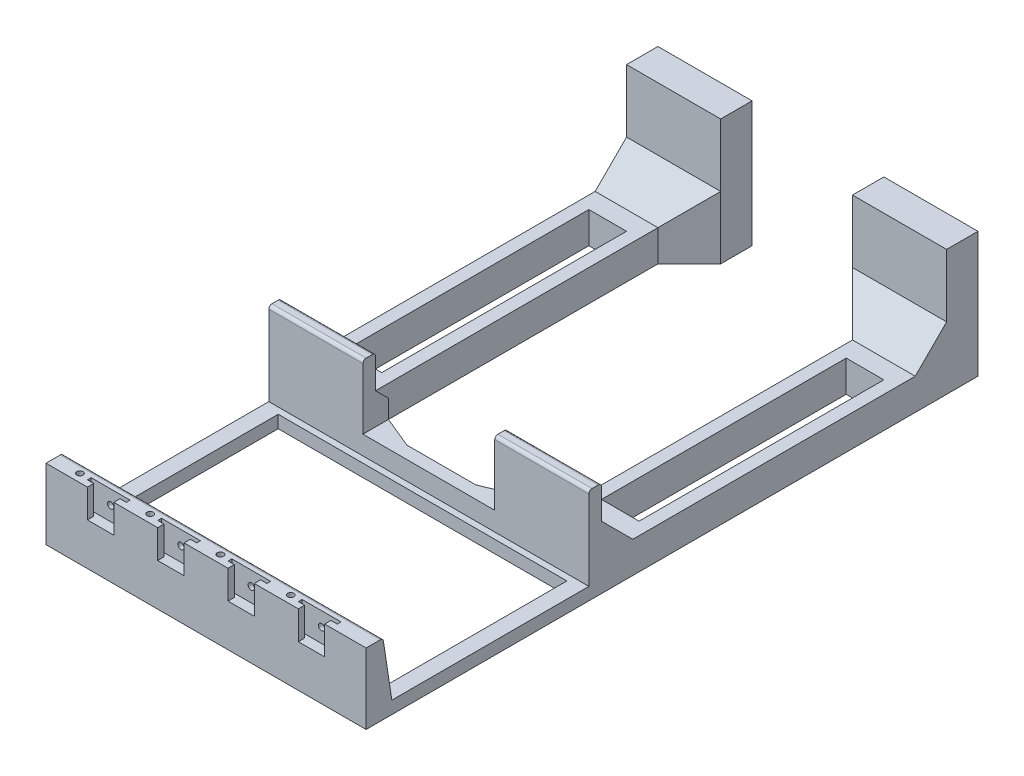
from build123d import *

# Parameters (mm, degrees)
SKETCH_1_W           = 102
SKETCH_1_H           = 75
EXTRUDE_1_DEPTH      = 22.5
CUT_EXTRUDE_1_DEPTH  = 9.06
SKETCH_3_W           = 102
SKETCH_3_H           = 66.8
CUT_EXTRUDE_2_DEPTH  = 12
SKETCH_4_W           = 62.8
SKETCH_4_H           = 6.5
CUT_EXTRUDE_3_DEPTH  = 129.589463021
SKETCH_6_W           = 102
SKETCH_6_H           = 4
EXTRUDE_2_DEPTH      = 20
SKETCH_7_W           = 92
SKETCH_7_H           = 58.8
CUT_EXTRUDE_5_DEPTH  = 8
CUT_EXTRUDE_6_DEPTH  = 108
FILLET_2_R           = 1
SKETCH_10_R          = 1
CUT_EXTRUDE_7_DEPTH  = 10
SKETCH_14_R          = 1
CUT_EXTRUDE_8_DEPTH  = 10
SKETCH_15_W          = 20
SKETCH_15_H          = 10
EXTRUDE_3_DEPTH      = 120
SKETCH_16_W          = 10
SKETCH_16_H          = 10
EXTRUDE_4_DEPTH      = 80
CHAMFER_1_SIZE       = 10
SKETCH_17_W          = 102
SKETCH_17_H          = 10
EXTRUDE_5_DEPTH      = 30
CUT_EXTRUDE_9_DEPTH  = 50
SKETCH_20_W          = 12
SKETCH_20_H          = 78
CUT_EXTRUDE_10_DEPTH = 50
SKETCH_21_W          = 4
SKETCH_21_H          = 10
EXTRUDE_6_DEPTH      = 50
CHAMFER_2_SIZE       = 10
CHAMFER_3_SIZE       = 10


with BuildPart() as part:
    # 草图1 → 凸台-拉伸1 (new body)
    with BuildSketch(Plane(origin=(0, 0, 0), x_dir=(1, 0, 0), z_dir=(0, 1, 0))):
        with Locations((-51, 37.5)):
            Rectangle(SKETCH_1_W, SKETCH_1_H)
    extrude(amount=EXTRUDE_1_DEPTH)

    # 草图2 → 切除-拉伸1 (cut)
    with BuildSketch(Plane(origin=(0, 22.5, 0), x_dir=(1, 0, 0), z_dir=(0, 1, 0))):
        Polygon((-90.8, 2), (-88.8, 2), (-88.8, 0), (-80.4, 0), (-80.4, 2), (-78.4, 2), (-78.4, 3.2), (-90.8, 3.2), align=None)
        Polygon((-68.4, 2), (-66.4, 2), (-66.4, 0), (-58, 0), (-58, 2), (-56, 2), (-56, 3.2), (-68.4, 3.2), align=None)
        Polygon((-46, 3.2), (-33.6, 3.2), (-33.6, 2), (-35.6, 2), (-35.6, 0), (-44, 0), (-44, 2), (-46, 2), align=None)
        Polygon((-23.6, 3.2), (-11.2, 3.2), (-11.2, 2), (-13.2, 2), (-13.2, 0), (-21.6, 0), (-21.6, 2), (-23.6, 2), align=None)
    extrude(amount=-CUT_EXTRUDE_1_DEPTH, mode=Mode.SUBTRACT)

    # 草图3 → 切除-拉伸2 (cut)
    with BuildSketch(Plane(origin=(0, 22.5, 0), x_dir=(1, 0, 0), z_dir=(0, 1, 0))):
        with Locations((-51, 41.6)):
            Rectangle(SKETCH_3_W, SKETCH_3_H)
    extrude(amount=-CUT_EXTRUDE_2_DEPTH, mode=Mode.SUBTRACT)

    # 草图4 → 切除-拉伸3 (cut, through all)
    with BuildSketch(Plane.ZY.offset(102)):
        with Locations((-39.6, 7.25)):
            Rectangle(SKETCH_4_W, SKETCH_4_H)
    extrude(amount=-CUT_EXTRUDE_3_DEPTH, mode=Mode.SUBTRACT)

    # 草图6 → 凸台-拉伸2 (add)
    with BuildSketch(Plane(origin=(0, 10.5, 0), x_dir=(1, 0, 0), z_dir=(0, 1, 0))):
        with Locations((-51, 73)):
            Rectangle(SKETCH_6_W, SKETCH_6_H)
    extrude(amount=EXTRUDE_2_DEPTH)

    # 草图7 → 切除-拉伸5 (cut)
    with BuildSketch(Plane(origin=(0, 4, 0), x_dir=(1, 0, 0), z_dir=(0, 1, 0))):
        with Locations((-51, 39.6)):
            Rectangle(SKETCH_7_W, SKETCH_7_H)
    extrude(amount=-CUT_EXTRUDE_5_DEPTH, mode=Mode.SUBTRACT)

    # 草图9 → 切除-拉伸6 (cut)
    with BuildSketch(Plane.ZY.offset(102)):
        Polygon((-8.2, 22.5), (-5.4, 22.5), (-8.2, 4), align=None)
    extrude(amount=-CUT_EXTRUDE_6_DEPTH, mode=Mode.SUBTRACT)

    # 圆角2
    fillet_2_edges = [part.edges().sort_by_distance(p)[0] for p in [
        (-51, 30.5, -71),
        (-51, 30.5, -75),
        (-51, 22.5, -5.4),
    ]]
    fillet(fillet_2_edges, radius=FILLET_2_R)

    # 草图10 → 切除-拉伸7 (cut)
    with BuildSketch(Plane.XY.offset(-3.2)):
        with Locations((-84.6, 17.97)):
            Circle(SKETCH_10_R)
        with Locations((-62.2, 17.97)):
            Circle(SKETCH_10_R)
        with Locations(Location((-39.8, 17.97, 0), (0, 0, 90))):
            Circle(SKETCH_10_R)
        with Locations(Location((-17.4, 17.97, 0), (0, 0, 90))):
            Circle(SKETCH_10_R)
    extrude(amount=-CUT_EXTRUDE_7_DEPTH, mode=Mode.SUBTRACT)

    # 草图14 → 切除-拉伸8 (cut)
    with BuildSketch(Plane(origin=(0, 22.5, 0), x_dir=(1, 0, 0), z_dir=(0, 1, 0))):
        with Locations(Location((-93.8, 2.6, 0), (0, 0, 270))):
            Circle(SKETCH_14_R)
        with Locations(Location((-71.4, 2.6, 0), (0, 0, 270))):
            Circle(SKETCH_14_R)
        with Locations(Location((-49, 2.6, 0), (0, 0, 270))):
            Circle(SKETCH_14_R)
        with Locations(Location((-26.6, 2.6, 0), (0, 0, 270))):
            Circle(SKETCH_14_R)
    extrude(amount=-CUT_EXTRUDE_8_DEPTH, mode=Mode.SUBTRACT)

    # 草图15 → 凸台-拉伸3 (add)
    with BuildSketch(Plane(origin=(0, 0, -75), x_dir=(-1, 0, 0), z_dir=(0, 0, -1))):
        with Locations((10, 5)):
            Rectangle(SKETCH_15_W, SKETCH_15_H)
        with Locations((92, 5)):
            Rectangle(SKETCH_15_W, SKETCH_15_H)
    extrude(amount=EXTRUDE_3_DEPTH)

    # 草图16 → 凸台-拉伸4 (add)
    with BuildSketch(Plane(origin=(-82, 0, 0), x_dir=(0, 0, -1), z_dir=(1, 0, 0))):
        with Locations((190, 5)):
            Rectangle(SKETCH_16_W, SKETCH_16_H)
    extrude(amount=EXTRUDE_4_DEPTH)

    # 倒角1
    chamfer_1_edges = [part.edges().sort_by_distance(p)[0] for p in [
        (-20, 5, -75),
        (-82, 5, -75),
        (-20, 5, -185),
        (-82, 5, -185),
    ]]
    chamfer(chamfer_1_edges, length=CHAMFER_1_SIZE)

    # 草图17 → 凸台-拉伸5 (add)
    with BuildSketch(Plane(origin=(0, 10, 0), x_dir=(1, 0, 0), z_dir=(0, 1, 0))):
        with Locations((-51, 190)):
            Rectangle(SKETCH_17_W, SKETCH_17_H)
    extrude(amount=EXTRUDE_5_DEPTH)

    # 草图19 → 切除-拉伸9 (cut)
    with BuildSketch(Plane(origin=(0, 40, 0), x_dir=(1, 0, 0), z_dir=(0, 1, 0))):
        Polygon((-72, 185), (-72, 75), (-72, 71), (-30, 71), (-30, 75), (-30, 185), (-30, 195), (-72, 195), align=None)
    extrude(amount=-CUT_EXTRUDE_9_DEPTH, mode=Mode.SUBTRACT)

    # 草图20 → 切除-拉伸10 (cut)
    with BuildSketch(Plane(origin=(0, 10, 0), x_dir=(1, 0, 0), z_dir=(0, 1, 0))):
        with Locations((-92, 130)):
            Rectangle(SKETCH_20_W, SKETCH_20_H)
        with Locations((-10, 130)):
            Rectangle(SKETCH_20_W, SKETCH_20_H)
    extrude(amount=-CUT_EXTRUDE_10_DEPTH, mode=Mode.SUBTRACT)

    # 草图21 → 凸台-拉伸6 (add)
    with BuildSketch(Plane(origin=(-72, 0, 0), x_dir=(0, 0, -1), z_dir=(1, 0, 0))):
        with Locations((73, 5)):
            Rectangle(SKETCH_21_W, SKETCH_21_H)
    extrude(amount=EXTRUDE_6_DEPTH)

    # 倒角2
    # the kernel refuses this chamfer: 10 mm, written as the material it adds along each edge
    with BuildSketch(Plane(origin=(-30, 0, -75), x_dir=(-0.9998910622590237, 0, 0.01476020374253316), z_dir=(0, 1, 0))) as chamfer_2_piece_1:
        Polygon((CHAMFER_2_SIZE * 0.999891062259, -CHAMFER_2_SIZE * 0.0147602037425), (-CHAMFER_2_SIZE * 0.717466790729, -CHAMFER_2_SIZE * 0.696592710413), (0, 0), align=None)
    extrude(amount=10)
    with BuildSketch(Plane(origin=(-72, 0, -75), x_dir=(0.9998910622590237, 0, 0.01476020374253316), z_dir=(0, 1, 0))) as chamfer_2_piece_2:
        Polygon((CHAMFER_2_SIZE * 0.999891062259, CHAMFER_2_SIZE * 0.0147602037425), (-CHAMFER_2_SIZE * 0.717466790729, CHAMFER_2_SIZE * 0.696592710413), (0, 0), align=None)
    extrude(amount=10)

    # 倒角3
    # the kernel refuses this chamfer: 10 mm, written as the material it adds along each edge
    with BuildSketch(Plane(origin=(-30, 10, -75), x_dir=(0, -0.027495876610585588, -0.9996219169112968), z_dir=(1, 0, 0))) as chamfer_3_piece_1_section:
        Polygon((CHAMFER_3_SIZE * 0.999621916911, CHAMFER_3_SIZE * 0.0274958766106), (-CHAMFER_3_SIZE * 0.0274958766106, CHAMFER_3_SIZE * 0.999621916911), (0, 0), align=None)
    chamfer_3_piece_1 = extrude(amount=30, mode=Mode.PRIVATE)
    chamfer_3_piece_1 = split(chamfer_3_piece_1, bisect_by=Plane(origin=(-27.264199431, 13.202688984, -77.735800569), z_dir=(-0.7071067811865476, 0, -0.7071067811865476)), keep=Keep.TOP, mode=Mode.PRIVATE)
    chamfer_3_piece_1 = split(chamfer_3_piece_1, bisect_by=Plane(origin=(-28.501657804, 13.202688984, -79.762769282), z_dir=(0.382683432365518, 0, 0.9238795325111094)), keep=Keep.TOP, mode=Mode.PRIVATE)
    add(chamfer_3_piece_1)
    with BuildSketch(Plane(origin=(-30, 10, -75), x_dir=(0, -0.027495876610585588, -0.9996219169112968), z_dir=(1, 0, 0))) as chamfer_3_piece_2_section:
        Polygon((CHAMFER_3_SIZE * 0.999621916911, CHAMFER_3_SIZE * 0.0274958766106), (-CHAMFER_3_SIZE * 0.0274958766106, CHAMFER_3_SIZE * 0.999621916911), (0, 0), align=None)
    chamfer_3_piece_2 = extrude(amount=30, mode=Mode.PRIVATE)
    chamfer_3_piece_2 = split(chamfer_3_piece_2, bisect_by=Plane(origin=(-20, 10.692968827, -83.273838091), z_dir=(-1, 0, 0)), keep=Keep.TOP, mode=Mode.PRIVATE)
    chamfer_3_piece_2 = split(chamfer_3_piece_2, bisect_by=Plane(origin=(-21.434414815, 10.692968827, -83.565585185), z_dir=(0.7071067811865476, 0, 0.7071067811865476)), keep=Keep.TOP, mode=Mode.PRIVATE)
    chamfer_3_piece_2 = split(chamfer_3_piece_2, bisect_by=Plane(origin=(-20.979016586, 10.692968827, -82.8787493), z_dir=(-0.382683432365518, 0, -0.9238795325111094)), keep=Keep.TOP, mode=Mode.PRIVATE)
    add(chamfer_3_piece_2)
    with BuildSketch(Plane(origin=(-30, 10, -75), x_dir=(0, -0.027495876610585588, -0.9996219169112968), z_dir=(1, 0, 0))) as chamfer_3_piece_3_section:
        Polygon((CHAMFER_3_SIZE * 0.999621916911, CHAMFER_3_SIZE * 0.0274958766106), (-CHAMFER_3_SIZE * 0.0274958766106, CHAMFER_3_SIZE * 0.999621916911), (0, 0), align=None)
    chamfer_3_piece_3 = extrude(amount=30, mode=Mode.PRIVATE)
    chamfer_3_piece_3 = split(chamfer_3_piece_3, bisect_by=Plane(origin=(-20, 13.842005871, -77.275424956), z_dir=(-1, 0, 0)), keep=Keep.TOP, mode=Mode.PRIVATE)
    chamfer_3_piece_3 = split(chamfer_3_piece_3, bisect_by=Plane(origin=(-25.789156248, 13.842005871, -79.210843752), z_dir=(0.7071067811865476, 0, 0.7071067811865476)), keep=Keep.TOP, mode=Mode.PRIVATE)
    chamfer_3_piece_3 = split(chamfer_3_piece_3, bisect_by=Plane(origin=(-25.413818648, 13.842005871, -81.041794139), z_dir=(0.382683432365518, 0, 0.9238795325111094)), keep=Keep.TOP, mode=Mode.PRIVATE)
    add(chamfer_3_piece_3)
    with BuildSketch(Plane(origin=(-30, 10, -75), x_dir=(0, -0.027495876610585588, -0.9996219169112968), z_dir=(1, 0, 0))) as chamfer_3_piece_4_section:
        Polygon((CHAMFER_3_SIZE * 0.999621916911, CHAMFER_3_SIZE * 0.0274958766106), (-CHAMFER_3_SIZE * 0.0274958766106, CHAMFER_3_SIZE * 0.999621916911), (0, 0), align=None)
    chamfer_3_piece_4 = extrude(amount=30, mode=Mode.PRIVATE)
    chamfer_3_piece_4 = split(chamfer_3_piece_4, bisect_by=Plane(origin=(-20, 10.112698884, -84.362076481), z_dir=(1, 0, 0)), keep=Keep.TOP, mode=Mode.PRIVATE)
    chamfer_3_piece_4 = split(chamfer_3_piece_4, bisect_by=Plane(origin=(-19.665237882, 10.112698884, -85.334762118), z_dir=(0.7071067811865476, 0, 0.7071067811865476)), keep=Keep.TOP, mode=Mode.PRIVATE)
    chamfer_3_piece_4 = split(chamfer_3_piece_4, bisect_by=Plane(origin=(-18.50296184, 10.112698884, -83.904364757), z_dir=(-0.382683432365518, 0, -0.9238795325111094)), keep=Keep.TOP, mode=Mode.PRIVATE)
    add(chamfer_3_piece_4)
    with BuildSketch(Plane(origin=(-30, 10, -75), x_dir=(0, -0.027495876610585588, -0.9996219169112968), z_dir=(1, 0, 0))) as chamfer_3_piece_5_section:
        Polygon((CHAMFER_3_SIZE * 0.999621916911, CHAMFER_3_SIZE * 0.0274958766106), (-CHAMFER_3_SIZE * 0.0274958766106, CHAMFER_3_SIZE * 0.999621916911), (0, 0), align=None)
    chamfer_3_piece_5 = extrude(amount=30, mode=Mode.PRIVATE)
    chamfer_3_piece_5 = split(chamfer_3_piece_5, bisect_by=Plane(origin=(-20, 13.309351743, -78.276203383), z_dir=(1, 0, 0)), keep=Keep.TOP, mode=Mode.PRIVATE)
    chamfer_3_piece_5 = split(chamfer_3_piece_5, bisect_by=Plane(origin=(-13.20849449, 13.309351743, -86.097404939), z_dir=(0.382683432365518, 0, 0.9238795325111094)), keep=Keep.TOP, mode=Mode.PRIVATE)
    add(chamfer_3_piece_5)
    with BuildSketch(Plane(origin=(-72, 10, -75), x_dir=(0, -0.027495876610586147, -0.9996219169112968), z_dir=(-1, 0, 0))) as chamfer_3_piece_6_section:
        Polygon((CHAMFER_3_SIZE * 0.999621916911, -CHAMFER_3_SIZE * 0.0274958766106), (-CHAMFER_3_SIZE * 0.0274958766106, -CHAMFER_3_SIZE * 0.999621916911), (0, 0), align=None)
    chamfer_3_piece_6 = extrude(amount=30, mode=Mode.PRIVATE)
    chamfer_3_piece_6 = split(chamfer_3_piece_6, bisect_by=Plane(origin=(-73.498342196, 13.202688984, -79.762769282), z_dir=(-0.382683432365518, 0, 0.9238795325111094)), keep=Keep.TOP, mode=Mode.PRIVATE)
    chamfer_3_piece_6 = split(chamfer_3_piece_6, bisect_by=Plane(origin=(-74.735800569, 13.202688984, -77.735800569), z_dir=(0.7071067811865476, 0, -0.7071067811865476)), keep=Keep.TOP, mode=Mode.PRIVATE)
    add(chamfer_3_piece_6)
    with BuildSketch(Plane(origin=(-72, 10, -75), x_dir=(0, -0.027495876610586147, -0.9996219169112968), z_dir=(-1, 0, 0))) as chamfer_3_piece_7_section:
        Polygon((CHAMFER_3_SIZE * 0.999621916911, -CHAMFER_3_SIZE * 0.0274958766106), (-CHAMFER_3_SIZE * 0.0274958766106, -CHAMFER_3_SIZE * 0.999621916911), (0, 0), align=None)
    chamfer_3_piece_7 = extrude(amount=30, mode=Mode.PRIVATE)
    chamfer_3_piece_7 = split(chamfer_3_piece_7, bisect_by=Plane(origin=(-81.020983414, 10.692968827, -82.8787493), z_dir=(0.382683432365518, 0, -0.9238795325111094)), keep=Keep.TOP, mode=Mode.PRIVATE)
    chamfer_3_piece_7 = split(chamfer_3_piece_7, bisect_by=Plane(origin=(-80.565585185, 10.692968827, -83.565585185), z_dir=(-0.7071067811865476, 0, 0.7071067811865476)), keep=Keep.TOP, mode=Mode.PRIVATE)
    chamfer_3_piece_7 = split(chamfer_3_piece_7, bisect_by=Plane(origin=(-82, 10.692968827, -83.273838091), z_dir=(1, 0, 0)), keep=Keep.TOP, mode=Mode.PRIVATE)
    add(chamfer_3_piece_7)
    with BuildSketch(Plane(origin=(-72, 10, -75), x_dir=(0, -0.027495876610586147, -0.9996219169112968), z_dir=(-1, 0, 0))) as chamfer_3_piece_8_section:
        Polygon((CHAMFER_3_SIZE * 0.999621916911, -CHAMFER_3_SIZE * 0.0274958766106), (-CHAMFER_3_SIZE * 0.0274958766106, -CHAMFER_3_SIZE * 0.999621916911), (0, 0), align=None)
    chamfer_3_piece_8 = extrude(amount=30, mode=Mode.PRIVATE)
    chamfer_3_piece_8 = split(chamfer_3_piece_8, bisect_by=Plane(origin=(-76.586181352, 13.842005871, -81.041794139), z_dir=(-0.382683432365518, 0, 0.9238795325111094)), keep=Keep.TOP, mode=Mode.PRIVATE)
    chamfer_3_piece_8 = split(chamfer_3_piece_8, bisect_by=Plane(origin=(-76.210843752, 13.842005871, -79.210843752), z_dir=(-0.7071067811865476, 0, 0.7071067811865476)), keep=Keep.TOP, mode=Mode.PRIVATE)
    chamfer_3_piece_8 = split(chamfer_3_piece_8, bisect_by=Plane(origin=(-82, 13.842005871, -77.275424956), z_dir=(1, 0, 0)), keep=Keep.TOP, mode=Mode.PRIVATE)
    add(chamfer_3_piece_8)
    with BuildSketch(Plane(origin=(-72, 10, -75), x_dir=(0, -0.027495876610586147, -0.9996219169112968), z_dir=(-1, 0, 0))) as chamfer_3_piece_9_section:
        Polygon((CHAMFER_3_SIZE * 0.999621916911, -CHAMFER_3_SIZE * 0.0274958766106), (-CHAMFER_3_SIZE * 0.0274958766106, -CHAMFER_3_SIZE * 0.999621916911), (0, 0), align=None)
    chamfer_3_piece_9 = extrude(amount=30, mode=Mode.PRIVATE)
    chamfer_3_piece_9 = split(chamfer_3_piece_9, bisect_by=Plane(origin=(-83.49703816, 10.112698884, -83.904364757), z_dir=(0.382683432365518, 0, -0.9238795325111094)), keep=Keep.TOP, mode=Mode.PRIVATE)
    chamfer_3_piece_9 = split(chamfer_3_piece_9, bisect_by=Plane(origin=(-82.334762118, 10.112698884, -85.334762118), z_dir=(-0.7071067811865476, 0, 0.7071067811865476)), keep=Keep.TOP, mode=Mode.PRIVATE)
    chamfer_3_piece_9 = split(chamfer_3_piece_9, bisect_by=Plane(origin=(-82, 10.112698884, -84.362076481), z_dir=(-1, 0, 0)), keep=Keep.TOP, mode=Mode.PRIVATE)
    add(chamfer_3_piece_9)
    with BuildSketch(Plane(origin=(-72, 10, -75), x_dir=(0, -0.027495876610586147, -0.9996219169112968), z_dir=(-1, 0, 0))) as chamfer_3_piece_10_section:
        Polygon((CHAMFER_3_SIZE * 0.999621916911, -CHAMFER_3_SIZE * 0.0274958766106), (-CHAMFER_3_SIZE * 0.0274958766106, -CHAMFER_3_SIZE * 0.999621916911), (0, 0), align=None)
    chamfer_3_piece_10 = extrude(amount=30, mode=Mode.PRIVATE)
    chamfer_3_piece_10 = split(chamfer_3_piece_10, bisect_by=Plane(origin=(-88.79150551, 13.309351743, -86.097404939), z_dir=(-0.382683432365518, 0, 0.9238795325111094)), keep=Keep.TOP, mode=Mode.PRIVATE)
    chamfer_3_piece_10 = split(chamfer_3_piece_10, bisect_by=Plane(origin=(-82, 13.309351743, -78.276203383), z_dir=(-1, 0, 0)), keep=Keep.TOP, mode=Mode.PRIVATE)
    add(chamfer_3_piece_10)
    with BuildSketch(Plane(origin=(-72, 10, -185), x_dir=(0, -0.027495876610586528, 0.9996219169112968), z_dir=(-1, 0, 0))) as chamfer_3_piece_11_section:
        Polygon((CHAMFER_3_SIZE * 0.999621916911, CHAMFER_3_SIZE * 0.0274958766106), (-CHAMFER_3_SIZE * 0.0274958766106, CHAMFER_3_SIZE * 0.999621916911), (0, 0), align=None)
    chamfer_3_piece_11 = extrude(amount=30, mode=Mode.PRIVATE)
    chamfer_3_piece_11 = split(chamfer_3_piece_11, bisect_by=Plane(origin=(-82, 13.801206253, -182.64685828), z_dir=(1, 0, 0)), keep=Keep.TOP, mode=Mode.PRIVATE)
    chamfer_3_piece_11 = split(chamfer_3_piece_11, bisect_by=Plane(origin=(-76.267264743, 13.801206253, -180.732735257), z_dir=(-0.7071067811865476, 0, -0.7071067811865476)), keep=Keep.TOP, mode=Mode.PRIVATE)
    add(chamfer_3_piece_11)
    with BuildSketch(Plane(origin=(-72, 10, -185), x_dir=(0, -0.027495876610586528, 0.9996219169112968), z_dir=(-1, 0, 0))) as chamfer_3_piece_12_section:
        Polygon((CHAMFER_3_SIZE * 0.999621916911, CHAMFER_3_SIZE * 0.0274958766106), (-CHAMFER_3_SIZE * 0.0274958766106, CHAMFER_3_SIZE * 0.999621916911), (0, 0), align=None)
    chamfer_3_piece_12 = extrude(amount=30, mode=Mode.PRIVATE)
    chamfer_3_piece_12 = split(chamfer_3_piece_12, bisect_by=Plane(origin=(-82, 13.297973997, -181.702135358), z_dir=(-1, 0, 0)), keep=Keep.TOP, mode=Mode.PRIVATE)
    chamfer_3_piece_12 = split(chamfer_3_piece_12, bisect_by=Plane(origin=(-83.648983948, 13.297973997, -173.351016052), z_dir=(-0.7071067811865476, 0, -0.7071067811865476)), keep=Keep.TOP, mode=Mode.PRIVATE)
    add(chamfer_3_piece_12)
    with BuildSketch(Plane(origin=(0, 10, -185), x_dir=(0, -0.027495876610586528, 0.9996219169112968), z_dir=(-1, 0, 0))) as chamfer_3_piece_13_section:
        Polygon((CHAMFER_3_SIZE * 0.999621916911, CHAMFER_3_SIZE * 0.0274958766106), (-CHAMFER_3_SIZE * 0.0274958766106, CHAMFER_3_SIZE * 0.999621916911), (0, 0), align=None)
    chamfer_3_piece_13 = extrude(amount=30, mode=Mode.PRIVATE)
    chamfer_3_piece_13 = split(chamfer_3_piece_13, bisect_by=Plane(origin=(-18.351016052, 13.297973997, -173.351016052), z_dir=(0.7071067811865476, 0, -0.7071067811865476)), keep=Keep.TOP, mode=Mode.PRIVATE)
    chamfer_3_piece_13 = split(chamfer_3_piece_13, bisect_by=Plane(origin=(-20, 13.297973997, -181.702135358), z_dir=(1, 0, 0)), keep=Keep.TOP, mode=Mode.PRIVATE)
    add(chamfer_3_piece_13)
    with BuildSketch(Plane(origin=(0, 10, -185), x_dir=(0, -0.027495876610586528, 0.9996219169112968), z_dir=(-1, 0, 0))) as chamfer_3_piece_14_section:
        Polygon((CHAMFER_3_SIZE * 0.999621916911, CHAMFER_3_SIZE * 0.0274958766106), (-CHAMFER_3_SIZE * 0.0274958766106, CHAMFER_3_SIZE * 0.999621916911), (0, 0), align=None)
    chamfer_3_piece_14 = extrude(amount=30, mode=Mode.PRIVATE)
    chamfer_3_piece_14 = split(chamfer_3_piece_14, bisect_by=Plane(origin=(-25.732735257, 13.801206253, -180.732735257), z_dir=(0.7071067811865476, 0, -0.7071067811865476)), keep=Keep.TOP, mode=Mode.PRIVATE)
    chamfer_3_piece_14 = split(chamfer_3_piece_14, bisect_by=Plane(origin=(-20, 13.801206253, -182.64685828), z_dir=(-1, 0, 0)), keep=Keep.TOP, mode=Mode.PRIVATE)
    add(chamfer_3_piece_14)


solid = part.part
